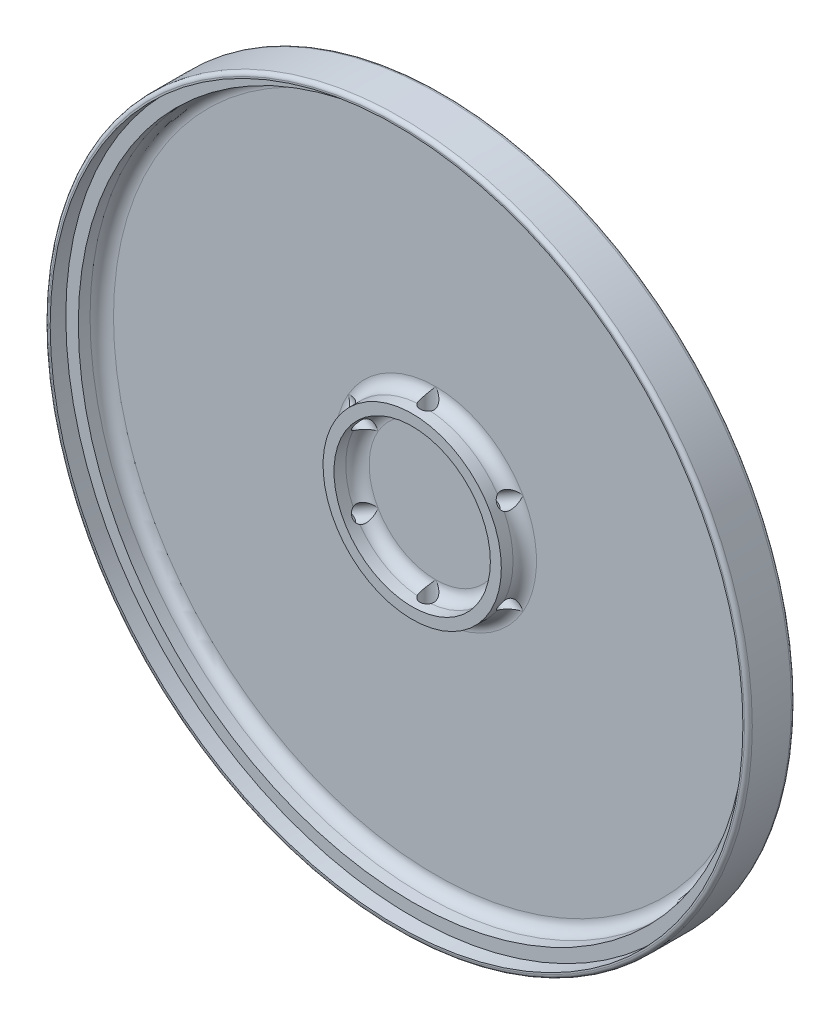
from build123d import *

# Parameters (mm, degrees)
SKETCH1_R                      = 90
SKETCH1_R_2                    = 88.6
SKETCH1_R_3                    = 85.4
SKETCH1_R_4                    = 22.8
SKETCH1_R_5                    = 20
BOSS_EXTRUDE1_DEPTH            = 2
BOSS_EXTRUDE2_START            = 10
SKETCH1_3_R                    = 90
SKETCH1_3_R_2                  = 88.6
BOSS_EXTRUDE2_DEPTH            = 10
BOSS_EXTRUDE3_START            = 6
SKETCH1_4_R                    = 88.6
SKETCH1_4_R_2                  = 85.4
BOSS_EXTRUDE3_DEPTH            = 6
SKETCH1_5_R                    = 22.8
SKETCH1_5_R_2                  = 20
BOSS_EXTRUDE4_DEPTH            = 6
CUT_EXTRUDE3_REACH             = 129.671
SKETCH2_R                      = 2
CUT_EXTRUDE3_DIRECTION_2_REACH = 129.671
FILLET1_R                      = 3
FILLET2_R                      = 3
FILLET3_R                      = 1
FILLET4_R                      = 1
CIRPATTERN1_COUNT              = 3


with BuildPart() as part:
    # Sketch1 → Boss-Extrude1 (new body)
    # profile 1 of 5: a face of its own
    with BuildSketch(Plane.XY):
        Circle(SKETCH1_R)
        Circle(SKETCH1_R_2, mode=Mode.SUBTRACT)
    # profile 2 of 5: a face of its own
    with BuildSketch(Plane.XY):
        Circle(SKETCH1_R_2)
        Circle(SKETCH1_R_3, mode=Mode.SUBTRACT)
    # profile 3 of 5: a face of its own
    with BuildSketch(Plane.XY):
        Circle(SKETCH1_R_3)
        Circle(SKETCH1_R_4, mode=Mode.SUBTRACT)
    # profile 4 of 5: a face of its own
    with BuildSketch(Plane.XY):
        Circle(SKETCH1_R_4)
        Circle(SKETCH1_R_5, mode=Mode.SUBTRACT)
    # profile 5 of 5: a face of its own
    with BuildSketch(Plane.XY):
        Circle(SKETCH1_R_5)
    extrude(amount=-BOSS_EXTRUDE1_DEPTH)

    # Sketch1<3> → Boss-Extrude2 (add)
    with BuildSketch(Plane.XY.offset(BOSS_EXTRUDE2_START)):
        Circle(SKETCH1_3_R)
        Circle(SKETCH1_3_R_2, mode=Mode.SUBTRACT)
    extrude(amount=-BOSS_EXTRUDE2_DEPTH)

    # Sketch1<4> → Boss-Extrude3 (add)
    with BuildSketch(Plane.XY.offset(BOSS_EXTRUDE3_START)):
        Circle(SKETCH1_4_R)
        Circle(SKETCH1_4_R_2, mode=Mode.SUBTRACT)
    extrude(amount=-BOSS_EXTRUDE3_DEPTH)

    # Sketch1<5> → Boss-Extrude4 (add)
    with BuildSketch(Plane.XY):
        Circle(SKETCH1_5_R)
        Circle(SKETCH1_5_R_2, mode=Mode.SUBTRACT)
    extrude(amount=BOSS_EXTRUDE4_DEPTH)

    # Sketch2 → Cut-Extrude3 (cut, up to next)
    with BuildSketch(Plane(origin=(0, 0, 0), x_dir=(1, 0, 0), z_dir=(0, 1, 0)), mode=Mode.PRIVATE) as cut_extrude3_sk1:
        with Locations(Location((0, -2, 0), (0, 0, 90))):
            Circle(SKETCH2_R)
    cut_extrude3_tool1 = extrude(cut_extrude3_sk1.sketch, amount=-CUT_EXTRUDE3_REACH, mode=Mode.PRIVATE) & part.part
    cut_extrude3 = cut_extrude3_tool1.solids().sort_by_distance((0, 0, 2))[0]
    add(cut_extrude3, mode=Mode.SUBTRACT)

    # Sketch2 → Cut-Extrude3 direction 2 (cut, up to next)
    with BuildSketch(Plane(origin=(0, 0, 0), x_dir=(1, 0, 0), z_dir=(0, 1, 0)), mode=Mode.PRIVATE) as cut_extrude3_direction_2_sk1:
        with Locations(Location((0, -2, 0), (0, 0, 90))):
            Circle(SKETCH2_R)
    cut_extrude3_direction_2_tool1 = extrude(cut_extrude3_direction_2_sk1.sketch, amount=CUT_EXTRUDE3_DIRECTION_2_REACH, mode=Mode.PRIVATE) & part.part
    cut_extrude3_direction_2 = cut_extrude3_direction_2_tool1.solids().sort_by_distance((0, 0, 2))[0]
    add(cut_extrude3_direction_2, mode=Mode.SUBTRACT)

    # Fillet1
    fillet1_edges = [part.edges().sort_by_distance(p)[0] for p in [
        (-85.4, 0, 0),
    ]]
    fillet(fillet1_edges, radius=FILLET1_R)

    # Fillet2
    # the kernel refuses this fillet: 3 mm, written as the material it adds along each edge
    with BuildSketch(Plane(origin=(0, 0, 0), x_dir=(1, 0, 0), z_dir=(0, -1, 0))) as fillet2_piece_1_section:
        with BuildLine():
            CenterArc((20 - FILLET2_R, FILLET2_R), FILLET2_R, 270, 90)
            Line((20 - FILLET2_R, 0), (20, 0))
            Line((20, 0), (20, FILLET2_R))
        make_face()
    fillet2_piece_1 = revolve(axis=Axis((0, 0, 0), (0, 0, 1)), revolution_arc=90, mode=Mode.PRIVATE)
    fillet2_piece_1 = fillet2_piece_1 - Plane(origin=(0, 13.541108847, 2), x_dir=(0, 0, -1), z_dir=(0, -1, 0)) * Cylinder(2, 80, mode=Mode.PRIVATE)
    add(fillet2_piece_1)
    with BuildSketch(Plane(origin=(0, 0, 0), x_dir=(0, 1, 0), z_dir=(1, 0, 0))) as fillet2_piece_2_section:
        with BuildLine():
            CenterArc((22.8 + FILLET2_R, FILLET2_R), FILLET2_R, 180, 90)
            Line((22.8, FILLET2_R), (22.8, 0))
            Line((22.8, 0), (22.8 + FILLET2_R, 0))
        make_face()
    fillet2_piece_2 = revolve(axis=Axis((0, 0, 0), (0, 0, 1)), revolution_arc=180, mode=Mode.PRIVATE)
    fillet2_piece_2 = fillet2_piece_2 - Plane(origin=(0, 0, 2), x_dir=(0, 0, -1), z_dir=(0, -1, 0)) * Cylinder(2, 104, mode=Mode.PRIVATE)
    add(fillet2_piece_2)
    with BuildSketch(Plane(origin=(0, 0, 0), x_dir=(0, 1, 0), z_dir=(1, 0, 0))) as fillet2_piece_3_section:
        with BuildLine():
            CenterArc((20 - FILLET2_R, FILLET2_R), FILLET2_R, 270, 90)
            Line((20 - FILLET2_R, 0), (20, 0))
            Line((20, 0), (20, FILLET2_R))
        make_face()
    fillet2_piece_3 = revolve(axis=Axis((0, 0, 0), (0, 0, 1)), revolution_arc=180, mode=Mode.PRIVATE)
    fillet2_piece_3 = fillet2_piece_3 - Plane(origin=(0, 0, 2), x_dir=(0, 0, -1), z_dir=(0, -1, 0)) * Cylinder(2, 80, mode=Mode.PRIVATE)
    add(fillet2_piece_3)
    with BuildSketch(Plane(origin=(0, 0, 0), x_dir=(0, -1, 0), z_dir=(-1, 0, 0))) as fillet2_piece_4_section:
        with BuildLine():
            CenterArc((22.8 + FILLET2_R, FILLET2_R), FILLET2_R, 180, 90)
            Line((22.8, FILLET2_R), (22.8, 0))
            Line((22.8, 0), (22.8 + FILLET2_R, 0))
        make_face()
    fillet2_piece_4 = revolve(axis=Axis((0, 0, 0), (0, 0, 1)), revolution_arc=90, mode=Mode.PRIVATE)
    fillet2_piece_4 = fillet2_piece_4 - Plane(origin=(0, -16.721645695, 2), x_dir=(0, 0, -1), z_dir=(0, 1, 0)) * Cylinder(2, 104, mode=Mode.PRIVATE)
    add(fillet2_piece_4)
    with BuildSketch(Plane(origin=(0, 0, 0), x_dir=(1, 0, 0), z_dir=(0, -1, 0))) as fillet2_piece_5_section:
        with BuildLine():
            CenterArc((22.8 + FILLET2_R, FILLET2_R), FILLET2_R, 180, 90)
            Line((22.8, FILLET2_R), (22.8, 0))
            Line((22.8, 0), (22.8 + FILLET2_R, 0))
        make_face()
    fillet2_piece_5 = revolve(axis=Axis((0, 0, 0), (0, 0, 1)), revolution_arc=90, mode=Mode.PRIVATE)
    fillet2_piece_5 = fillet2_piece_5 - Plane(origin=(0, 16.721645739, 2), x_dir=(0, 0, -1), z_dir=(0, -1, 0)) * Cylinder(2, 104, mode=Mode.PRIVATE)
    add(fillet2_piece_5)
    with BuildSketch(Plane(origin=(0, 0, 0), x_dir=(0, -1, 0), z_dir=(-1, 0, 0))) as fillet2_piece_6_section:
        with BuildLine():
            CenterArc((20 - FILLET2_R, FILLET2_R), FILLET2_R, 270, 90)
            Line((20 - FILLET2_R, 0), (20, 0))
            Line((20, 0), (20, FILLET2_R))
        make_face()
    fillet2_piece_6 = revolve(axis=Axis((0, 0, 0), (0, 0, 1)), revolution_arc=90, mode=Mode.PRIVATE)
    fillet2_piece_6 = fillet2_piece_6 - Plane(origin=(0, -13.541108804, 2), x_dir=(0, 0, -1), z_dir=(0, 1, 0)) * Cylinder(2, 80, mode=Mode.PRIVATE)
    add(fillet2_piece_6)

    # Fillet3
    fillet3_edges = [part.edges().sort_by_distance(p)[0] for p in [
        (-90, 0, -2),
    ]]
    fillet(fillet3_edges, radius=FILLET3_R)

    # Fillet4
    fillet4_edges = [part.edges().sort_by_distance(p)[0] for p in [
        (-90, 0, 10),
    ]]
    fillet(fillet4_edges, radius=FILLET4_R)

    # CirPattern1: Cut-Extrude3, Cut-Extrude3 direction 2; each copy of Cut-Extrude3, Cut-Extrude3 direction 2 runs up to whatever stops it at its own place
    cirpattern1_before = part.part  # the part as the pattern finds it: every copy runs up to it
    cirpattern1_cut_extrude3_long = extrude(cut_extrude3_sk1.sketch, amount=-CUT_EXTRUDE3_REACH, mode=Mode.PRIVATE)
    cirpattern1_cut_extrude3_tool1 = cirpattern1_cut_extrude3_long.rotate(Axis((0, 0, 6), (0, 0, -1)), 1 * 360 / CIRPATTERN1_COUNT) & cirpattern1_before
    add(cirpattern1_cut_extrude3_tool1.solids().sort_by_distance((0, 0, 2))[0], mode=Mode.SUBTRACT)
    cirpattern1_cut_extrude3_tool2 = cirpattern1_cut_extrude3_long.rotate(Axis((0, 0, 6), (0, 0, -1)), 2 * 360 / CIRPATTERN1_COUNT) & cirpattern1_before
    add(cirpattern1_cut_extrude3_tool2.solids().sort_by_distance((0, 0, 2))[0], mode=Mode.SUBTRACT)
    cirpattern1_cut_extrude3_direction_2_long = extrude(cut_extrude3_direction_2_sk1.sketch, amount=CUT_EXTRUDE3_DIRECTION_2_REACH, mode=Mode.PRIVATE)
    cirpattern1_cut_extrude3_direction_2_tool1 = cirpattern1_cut_extrude3_direction_2_long.rotate(Axis((0, 0, 6), (0, 0, -1)), 1 * 360 / CIRPATTERN1_COUNT) & cirpattern1_before
    add(cirpattern1_cut_extrude3_direction_2_tool1.solids().sort_by_distance((0, 0, 2))[0], mode=Mode.SUBTRACT)
    cirpattern1_cut_extrude3_direction_2_tool2 = cirpattern1_cut_extrude3_direction_2_long.rotate(Axis((0, 0, 6), (0, 0, -1)), 2 * 360 / CIRPATTERN1_COUNT) & cirpattern1_before
    add(cirpattern1_cut_extrude3_direction_2_tool2.solids().sort_by_distance((0, 0, 2))[0], mode=Mode.SUBTRACT)


solid = part.part
